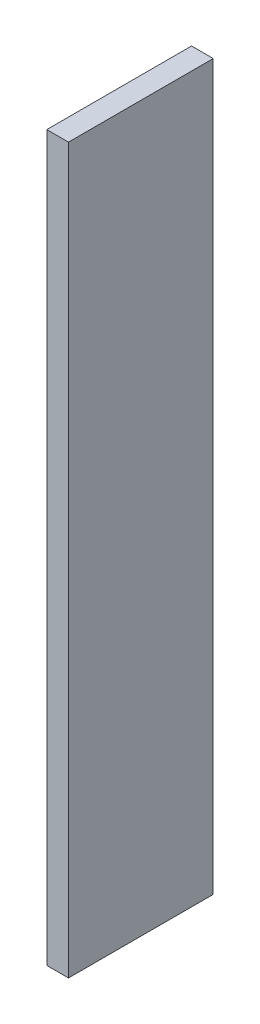
from build123d import *

# Parameters (mm, degrees)
SKETCH_3_W             = 30
SKETCH_3_H             = 1000
EXTRUDE_1_DEPTH        = 100
SKETCH_6_R             = 50
EXTRUDE_2_DEPTH        = 20
PATTERN_LINEAR_1_COUNT = 4
PATTERN_LINEAR_1_PITCH = 250


with BuildPart() as part:
    # 草图3 → 凸台-拉伸1 (new, symmetric)
    with BuildSketch(Plane.XY):
        Rectangle(SKETCH_3_W, SKETCH_3_H)
    extrude(amount=EXTRUDE_1_DEPTH, both=True)

    # 草图6 → 凸台-拉伸2 (add)
    with BuildSketch(Plane.ZY.offset(15)):
        with Locations((0, 375)):
            Circle(SKETCH_6_R)
    extrude_2 = extrude(amount=EXTRUDE_2_DEPTH)

    # 阵列(线性)1: 凸台-拉伸2 ×4
    with Locations(*[(0, -i * PATTERN_LINEAR_1_PITCH, 0) for i in range(1, PATTERN_LINEAR_1_COUNT)]):
        add(extrude_2)


solid = part.part
